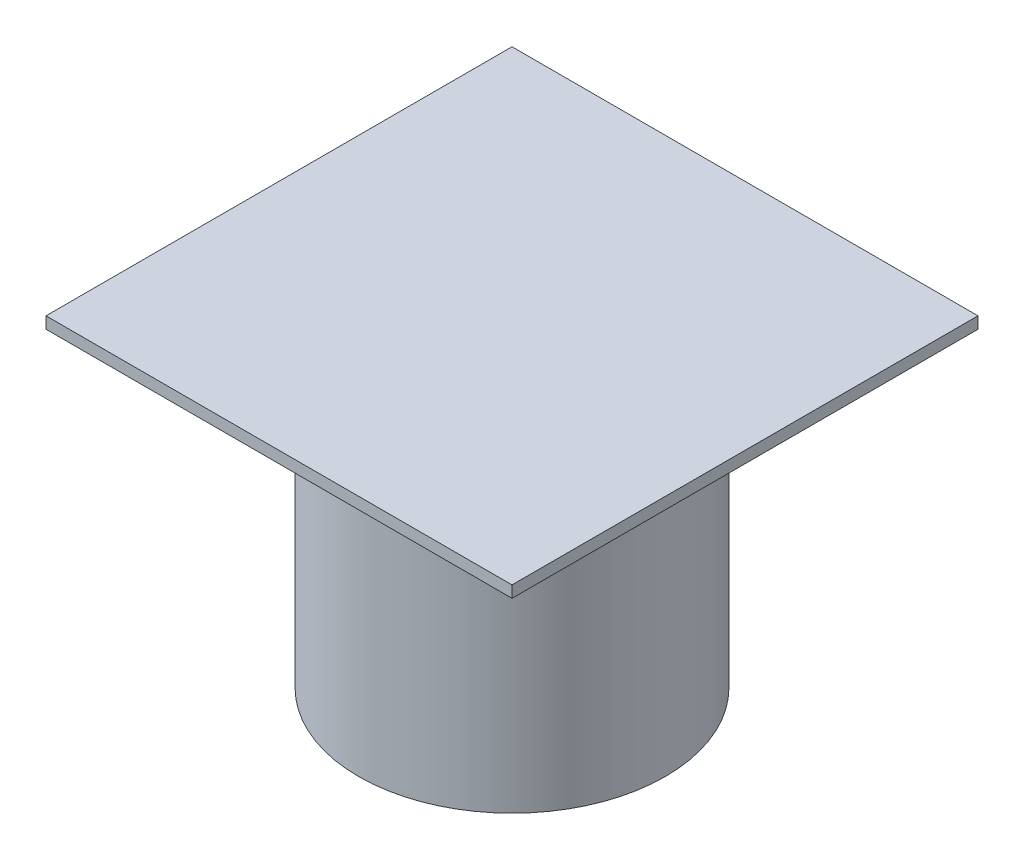
from build123d import *

# Parameters (mm, degrees)
SKETCH1_R           = 39.5
BOSS_EXTRUDE1_DEPTH = 80
SKETCH2_W           = 120
SKETCH2_H           = 120
BOSS_EXTRUDE2_DEPTH = 3


with BuildPart() as part:
    # Sketch1 → Boss-Extrude1 (new body)
    with BuildSketch(Plane(origin=(0, 0, 0), x_dir=(1, 0, 0), z_dir=(0, 1, 0))):
        Circle(SKETCH1_R)
    extrude(amount=BOSS_EXTRUDE1_DEPTH)

    # Sketch2 → Boss-Extrude2 (add)
    with BuildSketch(Plane(origin=(0, 80, 0), x_dir=(1, 0, 0), z_dir=(0, 1, 0))):
        Rectangle(SKETCH2_W, SKETCH2_H)
    extrude(amount=BOSS_EXTRUDE2_DEPTH)


solid = part.part
